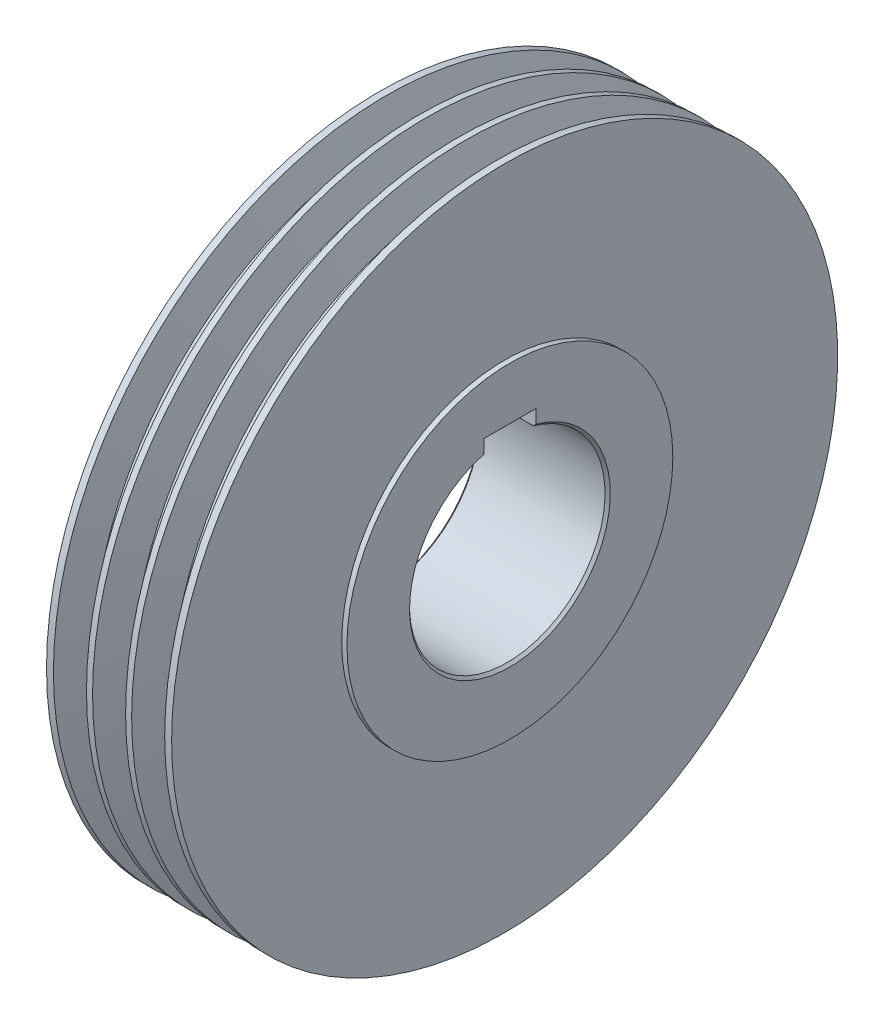
from build123d import *

# Parameters (mm, degrees)
PATTERN_LINEAR_1_COUNT = 3
PATTERN_LINEAR_1_PITCH = 15
CHAMFER_1_SIZE         = 1
SKETCH_4_W             = 20
SKETCH_4_H             = 6.257919263
CUT_EXTRUDE_1_DEPTH    = 188.456995068


with BuildPart() as part:
    # 草图1 → 旋转1 (revolve)
    with BuildSketch(Plane.XY):
        Polygon((0, 37.5), (0, 127.75), (48, 127.75), (48, 62.5), (50, 62.5), (50, 37.5), align=None)
    revolve(axis=Axis((0, 0, 0), (1, 0, 0)))

    # 草图2 → 切除-旋转1 (revolve, cut)
    with BuildSketch(Plane.XY):
        Polygon((11.840143071, 116.3), (15.340759374, 127.75), (2.659240626, 127.75), (6.159856929, 116.3), align=None)
    cut_revolve_1 = revolve(axis=Axis((0, 0, 0), (1, 0, 0)), mode=Mode.SUBTRACT)

    # 阵列(线性)1: 切除-旋转1 ×3
    with Locations(*[(i * PATTERN_LINEAR_1_PITCH, 0, 0) for i in range(1, PATTERN_LINEAR_1_COUNT)]):
        add(cut_revolve_1, mode=Mode.SUBTRACT)

    # 倒角1
    chamfer_1_edges = [part.edges().sort_by_distance(p)[0] for p in [
        (50, -37.5, 0),
        (0, -37.5, 0),
    ]]
    chamfer(chamfer_1_edges, length=CHAMFER_1_SIZE)

    # 草图4 → 切除-拉伸1 (cut, through all)
    with BuildSketch(Plane.ZY):
        with Locations((0, 39.271040369)):
            Rectangle(SKETCH_4_W, SKETCH_4_H)
    extrude(amount=-CUT_EXTRUDE_1_DEPTH, mode=Mode.SUBTRACT)


solid = part.part
